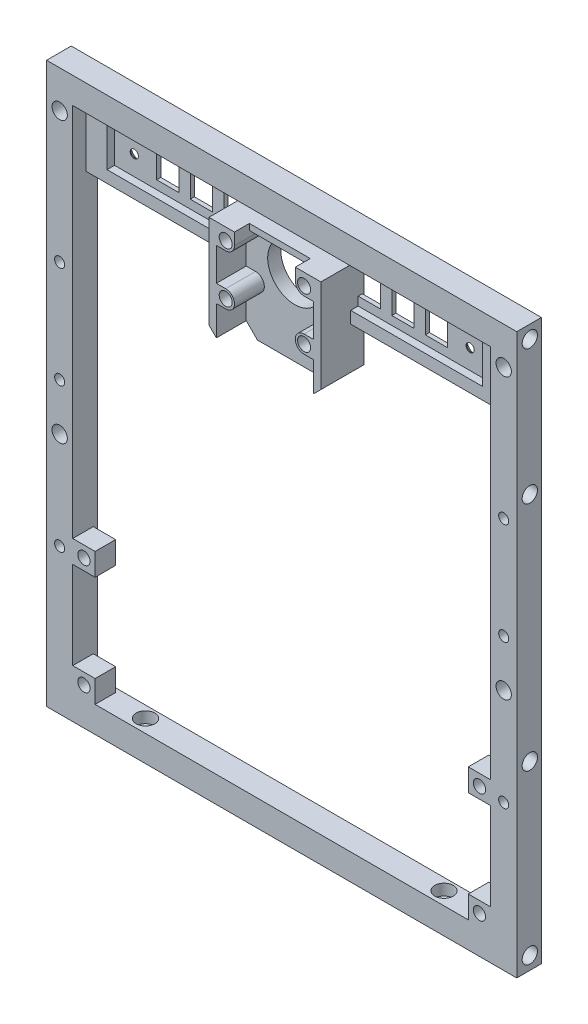
from build123d import *
from build123d.topology import SkipClean

# Parameters (mm, degrees)
SKETCH1_W                       = 126
SKETCH1_H                       = 150
SKETCH1_W_2                     = 112
SKETCH1_H_2                     = 136
BOSS_EXTRUDE1_DEPTH             = 7
SKETCH2_R                       = 2.05
CUT_EXTRUDE1_DEPTH              = 6
SKETCH3_R                       = 1.35
CUT_EXTRUDE2_DEPTH              = 157.419308271
SKETCH4_R                       = 2.5
CUT_EXTRUDE3_DEPTH              = 3
SKETCH5_R                       = 1.35
CUT_EXTRUDE4_DEPTH              = 99.198777996
SKETCH6_R                       = 2.5
CUT_EXTRUDE5_DEPTH              = 3
SKETCH7_R                       = 2.05
CUT_EXTRUDE6_DEPTH              = 99.198777996
CUT_EXTRUDE7_DEPTH              = 0.2
SKETCH9_W                       = 2.7
SKETCH9_H                       = 2.7
CUT_EXTRUDE8_DEPTH              = 0.2
SKETCH10_W                      = 6
SKETCH10_H                      = 6
BOSS_EXTRUDE2_DEPTH             = 5.5
SKETCH11_R                      = 1.65
CUT_EXTRUDE9_DEPTH              = 99.103261923
SKETCH12_W                      = 112
SKETCH12_H                      = 17
BOSS_EXTRUDE3_DEPTH             = 1.5
SKETCH13_W                      = 112
SKETCH13_H                      = 17
SKETCH13_W_2                    = 100.6
SKETCH13_H_2                    = 10.6
BOSS_EXTRUDE4_DEPTH             = 2
SKETCH14_W                      = 6
SKETCH14_H                      = 6
SKETCH14_W_2                    = 6.5
SKETCH14_H_2                    = 4
CUT_EXTRUDE10_DEPTH             = 99.103261923
SKETCH15_R                      = 1
BOSS_EXTRUDE5_DEPTH             = 2
CHAMFER1_SIZE                   = 0.4
CHAMFER2_SIZE                   = 0.4
CHAMFER3_SIZE                   = 0.4
SKETCH16_W                      = 6
SKETCH16_H                      = 6
BOSS_EXTRUDE7_DEPTH             = 5.5
SKETCH17_R                      = 1.65
CUT_EXTRUDE11_DEPTH             = 99.103261923
CUT_EXTRUDE12_DEPTH             = 99.103261923
CUT_EXTRUDE12_DEPTH_BACK        = 99.103261923
SKETCH18_R                      = 1.1
CHAMFER4_SIZE                   = 1.3
SKIZZE1_W                       = 112
SKIZZE1_H                       = 83.5
SCHNITT_LINEAR_AUSTRAGEN1_DEPTH = 5.5
SKIZZE2_W                       = 112
SKIZZE2_H                       = 3.2
SCHNITT_LINEAR_AUSTRAGEN2_DEPTH = 3.5
SKIZZE3_W                       = 25
SKIZZE3_H                       = 13.7
SKIZZE3_H_2                     = 8.1
SKIZZE3_W_2                     = 2.5
SKIZZE3_H_3                     = 3.2
AUFSATZ_LINEAR_AUSTRAGEN1_DEPTH = 3.5
SKIZZE4_R                       = 7.25
SCHNITT_LINEAR_AUSTRAGEN3_DEPTH = 10
AUFSATZ_LINEAR_START            = 8
SKIZZE4_3_R                     = 7.25
SKIZZE4_3_R_2                   = 1.75
SKIZZE4_3_W                     = 14.5
SKIZZE4_3_H                     = 14.5
AUFSATZ_LINEAR_AUSTRAGEN2_DEPTH = 8
SKIZZE4_4_R                     = 1.75
SCHNITT_LINEAR_AUSTRAGEN4_DEPTH = 8
SKIZZE6_W                       = 16.3
SKIZZE6_H                       = 1.636078696
SCHNITT_LINEAR_AUSTRAGEN5_DEPTH = 4
FASE1_SIZE                      = 5


with BuildPart() as part:
    # Sketch1 → Boss-Extrude1 (new body)
    with BuildSketch(Plane.XY):
        Rectangle(SKETCH1_W, SKETCH1_H)
        Rectangle(SKETCH1_W_2, SKETCH1_H_2, mode=Mode.SUBTRACT)
    extrude(amount=BOSS_EXTRUDE1_DEPTH)

    # Sketch2 → Cut-Extrude1 (cut)
    with BuildSketch(Plane.ZY.offset(63)):
        with Locations((3.5, -71.5)):
            Circle(SKETCH2_R)
        with Locations((3.5, 71.5)):
            Circle(SKETCH2_R)
        with Locations((3.5, 35.5)):
            Circle(SKETCH2_R)
        with Locations((3.5, -26.5)):
            Circle(SKETCH2_R)
    cut_extrude1 = extrude(amount=-CUT_EXTRUDE1_DEPTH, mode=Mode.SUBTRACT)

    # Mirror1: Cut-Extrude1 across plane
    add(cut_extrude1.mirror(Plane(origin=(0, 0, 0), x_dir=(0, 0, 1), z_dir=(1, 0, 0))), mode=Mode.SUBTRACT)

    # Sketch3 → Cut-Extrude2 (cut, through all)
    with BuildSketch(Plane(origin=(0, -68, 0), x_dir=(1, 0, 0), z_dir=(0, 1, 0))):
        with Locations(Location((40, -3.5, 0), (0, 0, 270))):
            Circle(SKETCH3_R)
        with Locations(Location((-40, -3.5, 0), (0, 0, 270))):
            Circle(SKETCH3_R)
    extrude(amount=-CUT_EXTRUDE2_DEPTH, mode=Mode.SUBTRACT)

    # Sketch4 → Cut-Extrude3 (cut)
    with BuildSketch(Plane(origin=(0, -68, 0), x_dir=(1, 0, 0), z_dir=(0, 1, 0))):
        with Locations(Location((40, -3.5, 0), (0, 0, 270))):
            Circle(SKETCH4_R)
        with Locations(Location((-40, -3.5, 0), (0, 0, 270))):
            Circle(SKETCH4_R)
    extrude(amount=-CUT_EXTRUDE3_DEPTH, mode=Mode.SUBTRACT)

    # Sketch5 → Cut-Extrude4 (cut, through all)
    with BuildSketch(Plane(origin=(0, 0, 0), x_dir=(-1, 0, 0), z_dir=(0, 0, -1))):
        with Locations((-59.5, 2.6)):
            Circle(SKETCH5_R)
        with Locations(Location((59.5, 2.6, 0), (0, 0, 180))):
            Circle(SKETCH5_R)
        with Locations((-59.5, -36)):
            Circle(SKETCH5_R)
        with Locations(Location((59.5, -36, 0), (0, 0, 180))):
            Circle(SKETCH5_R)
        with Locations((-59.5, 29.9)):
            Circle(SKETCH5_R)
        with Locations(Location((59.5, 29.9, 0), (0, 0, 180))):
            Circle(SKETCH5_R)
    extrude(amount=-CUT_EXTRUDE4_DEPTH, mode=Mode.SUBTRACT)

    # Sketch6 → Cut-Extrude5 (cut)
    with BuildSketch(Plane(origin=(0, 0, 0), x_dir=(-1, 0, 0), z_dir=(0, 0, -1))):
        with Locations((-59.5, 2.6)):
            Circle(SKETCH6_R)
        with Locations((59.5, 2.6)):
            Circle(SKETCH6_R)
        with Locations((-59.5, -36)):
            Circle(SKETCH6_R)
        with Locations((59.5, -36)):
            Circle(SKETCH6_R)
        with Locations((-59.5, 29.9)):
            Circle(SKETCH6_R)
        with Locations((59.5, 29.9)):
            Circle(SKETCH6_R)
    extrude(amount=-CUT_EXTRUDE5_DEPTH, mode=Mode.SUBTRACT)

    # Sketch7 → Cut-Extrude6 (cut, through all)
    with BuildSketch(Plane(origin=(0, 0, 0), x_dir=(-1, 0, 0), z_dir=(0, 0, -1))):
        with Locations((-59.5, 65)):
            Circle(SKETCH7_R)
        with Locations((-59.5, -10)):
            Circle(SKETCH7_R)
    cut_extrude6 = extrude(amount=-CUT_EXTRUDE6_DEPTH, mode=Mode.SUBTRACT)

    # Mirror2: Cut-Extrude6 across plane
    add(cut_extrude6.mirror(Plane(origin=(0, 0, 0), x_dir=(0, 0, 1), z_dir=(1, 0, 0))), mode=Mode.SUBTRACT)

    # Sketch8 → Cut-Extrude7 (cut)
    with SkipClean():  # the faces are left unmerged after this step: merging them gives an invalid solid
        with BuildSketch(Plane(origin=(0, 0, 3), x_dir=(-1, 0, 0), z_dir=(0, 0, -1))):
            with BuildLine():
                Line((-60.85, 32.004162541), (-60.85, 27.795837459))
                ThreePointArc((-60.85, 27.795837459), (-59.5, 27.4), (-58.15, 27.795837459))
                Line((-58.15, 27.795837459), (-58.15, 32.004162541))
                ThreePointArc((-58.15, 32.004162541), (-59.5, 32.4), (-60.85, 32.004162541))
            make_face()
            with BuildLine():
                Line((-60.85, 0.495837459), (-60.85, 4.704162541))
                ThreePointArc((-60.85, 4.704162541), (-59.5, 5.1), (-58.15, 4.704162541))
                Line((-58.15, 4.704162541), (-58.15, 0.495837459))
                ThreePointArc((-58.15, 0.495837459), (-59.5, 0.1), (-60.85, 0.495837459))
            make_face()
            with BuildLine():
                Line((-60.85, -38.104162541), (-60.85, -33.895837459))
                ThreePointArc((-60.85, -33.895837459), (-59.5, -33.5), (-58.15, -33.895837459))
                Line((-58.15, -33.895837459), (-58.15, -38.104162541))
                ThreePointArc((-58.15, -38.104162541), (-59.5, -38.5), (-60.85, -38.104162541))
            make_face()
        cut_extrude7 = extrude(amount=-CUT_EXTRUDE7_DEPTH, mode=Mode.SUBTRACT)

    # Sketch9 → Cut-Extrude8 (cut)
    with SkipClean():  # the faces are left unmerged after this step: merging them gives an invalid solid
        with BuildSketch(Plane(origin=(0, 0, 3.2), x_dir=(-1, 0, 0), z_dir=(0, 0, -1))):
            with Locations((-59.5, 2.6)):
                Rectangle(SKETCH9_W, SKETCH9_H)
            with Locations((-59.5, -36)):
                Rectangle(SKETCH9_W, SKETCH9_H)
        cut_extrude8 = extrude(amount=-CUT_EXTRUDE8_DEPTH, mode=Mode.SUBTRACT)

    # Mirror3: Cut-Extrude7, Cut-Extrude8 across plane
    with SkipClean():  # the faces are left unmerged after this step: merging them gives an invalid solid
        add(cut_extrude7.mirror(Plane(origin=(0, 0, 0), x_dir=(0, 0, 1), z_dir=(1, 0, 0))), mode=Mode.SUBTRACT)
        add(cut_extrude8.mirror(Plane(origin=(0, 0, 0), x_dir=(0, 0, 1), z_dir=(1, 0, 0))), mode=Mode.SUBTRACT)

    # Sketch10 → Boss-Extrude2 (add)
    with SkipClean():  # the faces are left unmerged after this step: merging them gives an invalid solid
        with BuildSketch(Plane.XY.offset(7)):
            with Locations((53, -65)):
                Rectangle(SKETCH10_W, SKETCH10_H)
            with Locations((53, -35.5)):
                Rectangle(SKETCH10_W, SKETCH10_H)
        boss_extrude2 = extrude(amount=-BOSS_EXTRUDE2_DEPTH)

    # Sketch11 → Cut-Extrude9 (cut, through all)
    with SkipClean():  # the faces are left unmerged after this step: merging them gives an invalid solid
        with BuildSketch(Plane(origin=(0, 0, 1.5), x_dir=(-1, 0, 0), z_dir=(0, 0, -1))):
            with Locations((-53, -35.5)):
                Circle(SKETCH11_R)
            with Locations((-53, -65)):
                Circle(SKETCH11_R)
        cut_extrude9 = extrude(amount=-CUT_EXTRUDE9_DEPTH, mode=Mode.SUBTRACT)

    # Mirror4: Boss-Extrude2, Cut-Extrude9 across plane
    with SkipClean():  # the faces are left unmerged after this step: merging them gives an invalid solid
        add(boss_extrude2.mirror(Plane(origin=(0, 0, 0), x_dir=(0, 0, 1), z_dir=(1, 0, 0))))
        add(cut_extrude9.mirror(Plane(origin=(0, 0, 0), x_dir=(0, 0, 1), z_dir=(1, 0, 0))), mode=Mode.SUBTRACT)

    # Sketch12 → Boss-Extrude3 (add)
    with SkipClean():  # the faces are left unmerged after this step: merging them gives an invalid solid
        with BuildSketch(Plane(origin=(0, 0, 0), x_dir=(-1, 0, 0), z_dir=(0, 0, -1))):
            with Locations((0, 59.5)):
                Rectangle(SKETCH12_W, SKETCH12_H)
        extrude(amount=-BOSS_EXTRUDE3_DEPTH)

    # Sketch13 → Boss-Extrude4 (add)
    with SkipClean():  # the faces are left unmerged after this step: merging them gives an invalid solid
        with BuildSketch(Plane.XY.offset(1.5)):
            with Locations((0, 59.5)):
                Rectangle(SKETCH13_W, SKETCH13_H)
            with Locations((0, 59.5)):
                Rectangle(SKETCH13_W_2, SKETCH13_H_2, mode=Mode.SUBTRACT)
        extrude(amount=BOSS_EXTRUDE4_DEPTH)

    # Sketch14 → Cut-Extrude10 (cut, through all)
    with SkipClean():  # the faces are left unmerged after this step: merging them gives an invalid solid
        with BuildSketch(Plane.XY.offset(1.5)):
            with Locations((-36, 59.5)):
                Rectangle(SKETCH14_W, SKETCH14_H)
            with Locations((0, 59.5)):
                Rectangle(SKETCH14_W_2, SKETCH14_H_2)
            with Locations((9, 59.5)):
                Rectangle(SKETCH14_W, SKETCH14_H)
            with Locations((18, 59.5)):
                Rectangle(SKETCH14_W, SKETCH14_H)
            with Locations((27, 59.5)):
                Rectangle(SKETCH14_W, SKETCH14_H)
            with Locations((36, 59.5)):
                Rectangle(SKETCH14_W, SKETCH14_H)
            with Locations((-27, 59.5)):
                Rectangle(SKETCH14_W, SKETCH14_H)
            with Locations((-18, 59.5)):
                Rectangle(SKETCH14_W, SKETCH14_H)
            with Locations((-9, 59.5)):
                Rectangle(SKETCH14_W, SKETCH14_H)
        extrude(amount=-CUT_EXTRUDE10_DEPTH, mode=Mode.SUBTRACT)

    # Sketch15 → Boss-Extrude5 (add)
    with SkipClean():  # the faces are left unmerged after this step: merging them gives an invalid solid
        with BuildSketch(Plane.XY.offset(1.5)):
            with Locations(Location((-45, 59.5, 0), (0, 0, 180))):
                Circle(SKETCH15_R)
            with Locations(Location((45, 59.5, 0), (0, 0, 180))):
                Circle(SKETCH15_R)
        extrude(amount=BOSS_EXTRUDE5_DEPTH)

    # Chamfer1
    # the kernel refuses this chamfer: 0.4 mm, written as the material it takes off along each edge
    with BuildSketch(Plane(origin=(56, -68, 0), x_dir=(0.9996219169112968, 0, -0.02749587661058673), z_dir=(0, 1, 0)), Plane(origin=(-56, 51, 0), x_dir=(-0.9996219169112968, 0, -0.02749587661058673), z_dir=(0, -1, 0))) as chamfer1_piece_1:
        Polygon((CHAMFER1_SIZE * 0.999621916911, -CHAMFER1_SIZE * 0.0274958766106), (-CHAMFER1_SIZE * 0.0274958766106, -CHAMFER1_SIZE * 0.999621916911), (0, 0), align=None)
    extrude(amount=119, mode=Mode.SUBTRACT)
    with BuildSketch(Plane(origin=(-56, -68, 0), x_dir=(0, -0.9996219169112966, -0.027495876610585536), z_dir=(1, 0, 0))) as chamfer1_piece_2:
        Polygon((CHAMFER1_SIZE * 0.999621916911, -CHAMFER1_SIZE * 0.0274958766106), (-CHAMFER1_SIZE * 0.0274958766106, -CHAMFER1_SIZE * 0.999621916911), (0, 0), align=None)
    extrude(amount=112, mode=Mode.SUBTRACT)
    with BuildSketch(Plane(origin=(-56, 51, 0), x_dir=(0, 0.9996219169112968, -0.02749587661058673), z_dir=(1, 0, 0))) as chamfer1_piece_3:
        Polygon((CHAMFER1_SIZE * 0.999621916911, CHAMFER1_SIZE * 0.0274958766106), (-CHAMFER1_SIZE * 0.0274958766106, CHAMFER1_SIZE * 0.999621916911), (0, 0), align=None)
    extrude(amount=112, mode=Mode.SUBTRACT)
    with BuildSketch(Plane(origin=(-56, -68, 0), x_dir=(0, -0.9996219169112966, -0.027495876610585536), z_dir=(1, 0, 0))) as chamfer1_piece_4a_section:
        Polygon((CHAMFER1_SIZE * 0.999621916911, -CHAMFER1_SIZE * 0.0274958766106), (-CHAMFER1_SIZE * 0.0274958766106, -CHAMFER1_SIZE * 0.999621916911), (0, 0), align=None)
    chamfer1_piece_4a = extrude(amount=113.028673195, mode=Mode.PRIVATE)
    chamfer1_piece_4a = split(chamfer1_piece_4a, bisect_by=Plane(origin=(56, -68.131917451, 0.131917451), z_dir=(1, 0, 0)), keep=Keep.TOP, mode=Mode.PRIVATE)
    with BuildSketch(Plane(origin=(56, -69.028673195, 0), x_dir=(0.9996219169112968, 0, -0.02749587661058673), z_dir=(0, 1, 0))) as chamfer1_piece_4b_section:
        Polygon((CHAMFER1_SIZE * 0.999621916911, -CHAMFER1_SIZE * 0.0274958766106), (-CHAMFER1_SIZE * 0.0274958766106, -CHAMFER1_SIZE * 0.999621916911), (0, 0), align=None)
    chamfer1_piece_4b = extrude(amount=120.028673195, mode=Mode.PRIVATE)
    chamfer1_piece_4b = split(chamfer1_piece_4b, bisect_by=Plane(origin=(56.131917451, -68, 0.131917451), z_dir=(0, -1, 0)), keep=Keep.TOP, mode=Mode.PRIVATE)
    chamfer1_piece_4 = chamfer1_piece_4a & chamfer1_piece_4b
    add(chamfer1_piece_4, mode=Mode.SUBTRACT)
    with BuildSketch(Plane(origin=(56, -68, 0), x_dir=(0.9996219169112968, 0, -0.02749587661058673), z_dir=(0, 1, 0))) as chamfer1_piece_5a_section:
        Polygon((CHAMFER1_SIZE * 0.999621916911, -CHAMFER1_SIZE * 0.0274958766106), (-CHAMFER1_SIZE * 0.0274958766106, -CHAMFER1_SIZE * 0.999621916911), (0, 0), align=None)
    chamfer1_piece_5a = extrude(amount=120.028673195, mode=Mode.PRIVATE)
    chamfer1_piece_5a = split(chamfer1_piece_5a, bisect_by=Plane(origin=(56.131917451, 51, 0.131917451), z_dir=(0, 1, 0)), keep=Keep.TOP, mode=Mode.PRIVATE)
    with BuildSketch(Plane(origin=(-56, 51, 0), x_dir=(0, 0.9996219169112968, -0.02749587661058673), z_dir=(1, 0, 0))) as chamfer1_piece_5b_section:
        Polygon((CHAMFER1_SIZE * 0.999621916911, CHAMFER1_SIZE * 0.0274958766106), (-CHAMFER1_SIZE * 0.0274958766106, CHAMFER1_SIZE * 0.999621916911), (0, 0), align=None)
    chamfer1_piece_5b = extrude(amount=113.028673195, mode=Mode.PRIVATE)
    chamfer1_piece_5b = split(chamfer1_piece_5b, bisect_by=Plane(origin=(56, 51.131917451, 0.131917451), z_dir=(1, 0, 0)), keep=Keep.TOP, mode=Mode.PRIVATE)
    chamfer1_piece_5 = chamfer1_piece_5a & chamfer1_piece_5b
    add(chamfer1_piece_5, mode=Mode.SUBTRACT)
    with BuildSketch(Plane(origin=(-56, 51, 0), x_dir=(-0.9996219169112968, 0, -0.02749587661058673), z_dir=(0, -1, 0))) as chamfer1_piece_6a_section:
        Polygon((CHAMFER1_SIZE * 0.999621916911, -CHAMFER1_SIZE * 0.0274958766106), (-CHAMFER1_SIZE * 0.0274958766106, -CHAMFER1_SIZE * 0.999621916911), (0, 0), align=None)
    chamfer1_piece_6a = extrude(amount=120.028673195, mode=Mode.PRIVATE)
    chamfer1_piece_6a = split(chamfer1_piece_6a, bisect_by=Plane(origin=(-56.131917451, -68, 0.131917451), z_dir=(0, -1, 0)), keep=Keep.TOP, mode=Mode.PRIVATE)
    with BuildSketch(Plane(origin=(-57.028673195, -68, 0), x_dir=(0, -0.9996219169112966, -0.027495876610585536), z_dir=(1, 0, 0))) as chamfer1_piece_6b_section:
        Polygon((CHAMFER1_SIZE * 0.999621916911, -CHAMFER1_SIZE * 0.0274958766106), (-CHAMFER1_SIZE * 0.0274958766106, -CHAMFER1_SIZE * 0.999621916911), (0, 0), align=None)
    chamfer1_piece_6b = extrude(amount=113.028673195, mode=Mode.PRIVATE)
    chamfer1_piece_6b = split(chamfer1_piece_6b, bisect_by=Plane(origin=(-56, -68.131917451, 0.131917451), z_dir=(-1, 0, 0)), keep=Keep.TOP, mode=Mode.PRIVATE)
    chamfer1_piece_6 = chamfer1_piece_6a & chamfer1_piece_6b
    add(chamfer1_piece_6, mode=Mode.SUBTRACT)
    with BuildSketch(Plane(origin=(-56, 52.028673195, 0), x_dir=(-0.9996219169112968, 0, -0.02749587661058673), z_dir=(0, -1, 0))) as chamfer1_piece_7a_section:
        Polygon((CHAMFER1_SIZE * 0.999621916911, -CHAMFER1_SIZE * 0.0274958766106), (-CHAMFER1_SIZE * 0.0274958766106, -CHAMFER1_SIZE * 0.999621916911), (0, 0), align=None)
    chamfer1_piece_7a = extrude(amount=120.028673195, mode=Mode.PRIVATE)
    chamfer1_piece_7a = split(chamfer1_piece_7a, bisect_by=Plane(origin=(-56.131917451, 51, 0.131917451), z_dir=(0, 1, 0)), keep=Keep.TOP, mode=Mode.PRIVATE)
    with BuildSketch(Plane(origin=(-57.028673195, 51, 0), x_dir=(0, 0.9996219169112968, -0.02749587661058673), z_dir=(1, 0, 0))) as chamfer1_piece_7b_section:
        Polygon((CHAMFER1_SIZE * 0.999621916911, CHAMFER1_SIZE * 0.0274958766106), (-CHAMFER1_SIZE * 0.0274958766106, CHAMFER1_SIZE * 0.999621916911), (0, 0), align=None)
    chamfer1_piece_7b = extrude(amount=113.028673195, mode=Mode.PRIVATE)
    chamfer1_piece_7b = split(chamfer1_piece_7b, bisect_by=Plane(origin=(-56, 51.131917451, 0.131917451), z_dir=(-1, 0, 0)), keep=Keep.TOP, mode=Mode.PRIVATE)
    chamfer1_piece_7 = chamfer1_piece_7a & chamfer1_piece_7b
    add(chamfer1_piece_7, mode=Mode.SUBTRACT)

    # Chamfer2
    chamfer2_edges = [part.edges().sort_by_distance(p)[0] for p in [
        (0, -75, 0),
        (-63, 0, 0),
        (0, 75, 0),
        (63, 0, 0),
    ]]
    chamfer(chamfer2_edges, length=CHAMFER2_SIZE)

    # Chamfer3
    chamfer3_edges = [part.edges().sort_by_distance(p)[0] for p in [
        (-6, 59.5, 0),
        (-9, 56.5, 0),
        (-12, 59.5, 0),
        (-9, 62.5, 0),
        (-15, 59.5, 0),
        (-18, 56.5, 0),
        (-21, 59.5, 0),
        (-18, 62.5, 0),
        (-24, 59.5, 0),
        (-27, 56.5, 0),
        (-30, 59.5, 0),
        (-27, 62.5, 0),
        (-33, 59.5, 0),
        (-36, 56.5, 0),
        (-39, 59.5, 0),
        (-36, 62.5, 0),
        (39, 59.5, 0),
        (36, 56.5, 0),
        (33, 59.5, 0),
        (36, 62.5, 0),
        (30, 59.5, 0),
        (27, 56.5, 0),
        (24, 59.5, 0),
        (27, 62.5, 0),
        (21, 59.5, 0),
        (18, 56.5, 0),
        (15, 59.5, 0),
        (18, 62.5, 0),
        (12, 59.5, 0),
        (9, 56.5, 0),
        (6, 59.5, 0),
        (9, 62.5, 0),
        (3.25, 59.5, 0),
        (0, 57.5, 0),
        (-3.25, 59.5, 0),
        (0, 61.5, 0),
    ]]
    chamfer(chamfer3_edges, length=CHAMFER3_SIZE)

    # Sketch16 → Boss-Extrude7 (add)
    with BuildSketch(Plane.XY.offset(7)):
        Polygon((-50, 51), (-50, 54.2), (-56, 54.2), (-56, 51), (-56, 45), (-50, 45), align=None)
        with Locations((-53, -29.5)):
            Rectangle(SKETCH16_W, SKETCH16_H)
        with Locations((53, -29.5)):
            Rectangle(SKETCH16_W, SKETCH16_H)
        Polygon((56, 51), (56, 45), (50, 45), (50, 51), (50, 54.2), (56, 54.2), align=None)
    extrude(amount=-BOSS_EXTRUDE7_DEPTH)

    # Sketch17 → Cut-Extrude11 (cut, through all)
    with BuildSketch(Plane(origin=(0, 0, 1.5), x_dir=(-1, 0, 0), z_dir=(0, 0, -1))):
        with Locations((-53, -29.5)):
            Circle(SKETCH17_R)
        with Locations((53, -29.5)):
            Circle(SKETCH17_R)
        with Locations((53, 48)):
            Circle(SKETCH17_R)
        with Locations((-53, 48)):
            Circle(SKETCH17_R)
    extrude(amount=-CUT_EXTRUDE11_DEPTH, mode=Mode.SUBTRACT)

    # Sketch18 → Cut-Extrude12 (cut, two sides: drawn at the far end of the back side and taken through both)
    with BuildSketch(Plane.XY.offset(1.5).offset(-CUT_EXTRUDE12_DEPTH_BACK)):
        with Locations((-45, 59.5)):
            Circle(SKETCH18_R)
        with Locations((45, 59.5)):
            Circle(SKETCH18_R)
    extrude(amount=CUT_EXTRUDE12_DEPTH + CUT_EXTRUDE12_DEPTH_BACK, mode=Mode.SUBTRACT)

    # Chamfer4
    chamfer4_edges = [part.edges().sort_by_distance(p)[0] for p in [
        (-46.1, 59.5, 0),
        (43.9, 59.5, 0),
    ]]
    chamfer(chamfer4_edges, length=CHAMFER4_SIZE)

    # Skizze1 → Schnitt-Linear austragen1 (cut)
    with BuildSketch(Plane.XY.offset(7)):
        with Locations((0, 9.25)):
            Rectangle(SKIZZE1_W, SKIZZE1_H)
    extrude(amount=-SCHNITT_LINEAR_AUSTRAGEN1_DEPTH, mode=Mode.SUBTRACT)

    # Skizze2 → Schnitt-Linear austragen2 (cut)
    with BuildSketch(Plane.XY.offset(7)):
        with Locations((0, 52.6)):
            Rectangle(SKIZZE2_W, SKIZZE2_H)
    extrude(amount=-SCHNITT_LINEAR_AUSTRAGEN2_DEPTH, mode=Mode.SUBTRACT)

    # Skizze3 → Aufsatz-Linear austragen1 (add)
    with BuildSketch(Plane.XY.offset(3.5)):
        with Locations((0, 44.15)):
            Rectangle(SKIZZE3_W, SKIZZE3_H)
        Polygon((-15, 51), (-15, 34.8), (15, 34.8), (15, 51), (12.5, 51), (12.5, 37.3), (-12.5, 37.3), (-12.5, 51), align=None)
        with Locations((0, 58.25)):
            Rectangle(SKIZZE3_W, SKIZZE3_H_2)
        Polygon((-15, 64.8), (-15, 54.2), (-12.5, 54.2), (-12.5, 62.3), (12.5, 62.3), (12.5, 54.2), (15, 54.2), (15, 64.8), align=None)
        with Locations((13.75, 52.6)):
            Rectangle(SKIZZE3_W_2, SKIZZE3_H_3)
        with Locations((0, 52.6)):
            Rectangle(SKIZZE3_W, SKIZZE3_H_3)
        with Locations((-13.75, 52.6)):
            Rectangle(SKIZZE3_W_2, SKIZZE3_H_3)
    extrude(amount=-AUFSATZ_LINEAR_AUSTRAGEN1_DEPTH)

    # Skizze4 → Schnitt-Linear austragen3 (cut)
    with BuildSketch(Plane.XY.offset(3.5)):
        with Locations((0, 55.275345236)):
            Circle(SKIZZE4_R)
    extrude(amount=-SCHNITT_LINEAR_AUSTRAGEN3_DEPTH, mode=Mode.SUBTRACT)

    # Skizze4<3> → Aufsatz-Linear austragen2 (add)
    # profile 1 of 3: a face of its own
    with BuildSketch(Plane.XY.offset(3.5).offset(AUFSATZ_LINEAR_START)):
        with Locations((0, 55.275345236)):
            Circle(SKIZZE4_3_R)
    # profile 2 of 3: a face of its own
    with BuildSketch(Plane.XY.offset(3.5).offset(AUFSATZ_LINEAR_START)):
        with BuildLine():
            Line((13, 59.275345236), (13, 50.475345236))
            Line((13, 50.475345236), (10.5, 50.475345236))
            ThreePointArc((10.5, 50.475345236), (8.15, 48.125345236), (10.5, 45.775345236))
            Line((10.5, 45.775345236), (13, 45.775345236))
            Line((13, 45.775345236), (13, 34.8))
            Line((13, 34.8), (15, 34.8))
            Line((15, 34.8), (15, 64.8))
            Line((15, 64.8), (-15, 64.8))
            Line((-15, 64.8), (-15, 34.8))
            Line((-15, 34.8), (-13, 34.8))
            Line((-13, 34.8), (-13, 45.775345236))
            Line((-13, 45.775345236), (-10.5, 45.775345236))
            ThreePointArc((-10.5, 45.775345236), (-8.15, 48.125345236), (-10.5, 50.475345236))
            Line((-10.5, 50.475345236), (-13, 50.475345236))
            Line((-13, 50.475345236), (-13, 59.275345236))
            Line((-13, 59.275345236), (-10.5, 59.275345236))
            ThreePointArc((-10.5, 59.275345236), (-8.838299064, 59.9636443), (-8.15, 61.625345236))
            Line((-8.15, 61.625345236), (-8.15, 63.163921304))
            Line((-8.15, 63.163921304), (8.15, 63.163921304))
            Line((8.15, 63.163921304), (8.15, 61.625345236))
            ThreePointArc((8.15, 61.625345236), (8.838299064, 59.9636443), (10.5, 59.275345236))
            Line((10.5, 59.275345236), (13, 59.275345236))
        make_face()
        with Locations((-10.5, 61.625345236)):
            Circle(SKIZZE4_3_R_2, mode=Mode.SUBTRACT)
        with Locations((10.5, 61.625345236)):
            Circle(SKIZZE4_3_R_2, mode=Mode.SUBTRACT)
        with Locations((-10.5, 48.125345236)):
            Circle(SKIZZE4_3_R_2, mode=Mode.SUBTRACT)
        with Locations((10.5, 48.125345236)):
            Circle(SKIZZE4_3_R_2, mode=Mode.SUBTRACT)
    # profile 3 of 3: a face of its own
    with BuildSketch(Plane.XY.offset(3.5).offset(AUFSATZ_LINEAR_START)):
        with Locations((0, 148.619641775)):
            Rectangle(SKIZZE4_3_W, SKIZZE4_3_H)
    extrude(amount=-AUFSATZ_LINEAR_AUSTRAGEN2_DEPTH)


with BuildPart() as aufsatz_linear_austragen2_kept_piece:
    # of the separate pieces the step leaves, the one the design keeps (aufsatz_linear_austragen2_pieces_kept)
    add(part.part.solids().sort_by_distance((-62.6, -74.6, 0))[0])

    # Skizze4<4> → Schnitt-Linear austragen4 (cut)
    with BuildSketch(Plane.XY.offset(3.5)):
        with Locations(Location((-10.5, 61.625345236, 0), (0, 0, 180))):
            Circle(SKIZZE4_4_R)
        with Locations(Location((10.5, 61.625345236, 0), (0, 0, 180))):
            Circle(SKIZZE4_4_R)
    extrude(amount=-SCHNITT_LINEAR_AUSTRAGEN4_DEPTH, mode=Mode.SUBTRACT)

    # Skizze6 → Schnitt-Linear austragen5 (cut)
    with BuildSketch(Plane.XY.offset(11.5)):
        with Locations((0, 63.981960652)):
            Rectangle(SKIZZE6_W, SKIZZE6_H)
    extrude(amount=-SCHNITT_LINEAR_AUSTRAGEN5_DEPTH, mode=Mode.SUBTRACT)

    # Fase1
    # the kernel refuses this chamfer: 5 mm, written as the material it takes off along each edge
    with BuildSketch(Plane(origin=(-15, 34.8, 24.35841494), x_dir=(-0.027495876610586317, 0.9996219169112968, 0), z_dir=(0, 0, -1)), Plane(origin=(15, 34.8, 24.35841494), x_dir=(-0.9996219169112968, -0.027495876610586317, 0), z_dir=(0, 0, -1))) as fase1_piece_1:
        Polygon((FASE1_SIZE * 0.999621916911, FASE1_SIZE * 0.0274958766106), (-FASE1_SIZE * 0.0274958766106, FASE1_SIZE * 0.999621916911), (0, 0), align=None)
    extrude(amount=20.85841494, mode=Mode.SUBTRACT)
    with BuildSketch(Plane(origin=(15, 34.8, 3.5), x_dir=(-0.9996219169112968, -0.027495876610586317, 0), z_dir=(0, 0, -1)), Plane(origin=(-15, 34.8, 3.5), x_dir=(-0.027495876610585973, 0.9996219169112968, 0), z_dir=(0, 0, -1))) as fase1_piece_2:
        Polygon((FASE1_SIZE * 0.999621916911, FASE1_SIZE * 0.0274958766106), (-FASE1_SIZE * 0.0274958766106, FASE1_SIZE * 0.999621916911), (0, 0), align=None)
    extrude(amount=16.35841494, mode=Mode.SUBTRACT)


solid = aufsatz_linear_austragen2_kept_piece.part
